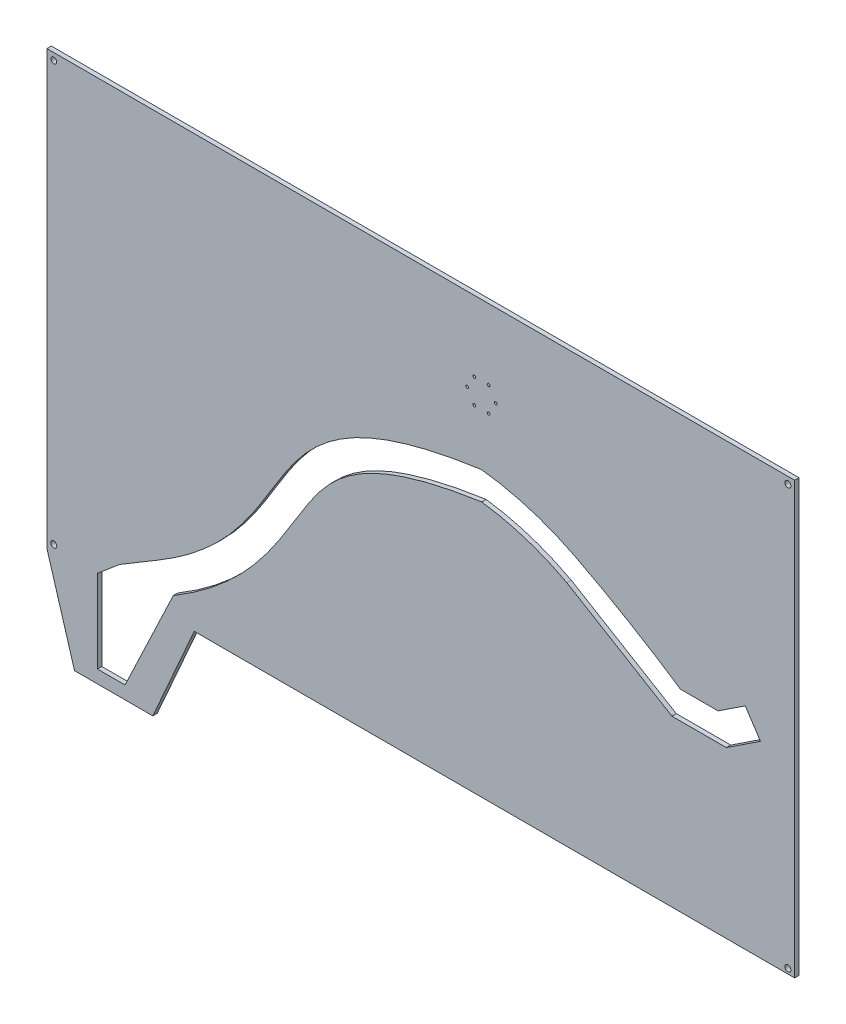
from build123d import *

# Parameters (mm, degrees)
SKETCH1_R           = 3.292374312
SKETCH1_R_2         = 3.294421934
SKETCH1_R_3         = 3.163533699
SKETCH1_R_4         = 1.5
BOSS_EXTRUDE1_DEPTH = 4.7625


with BuildPart() as part:
    # Sketch1 → Boss-Extrude1 (new body)
    with BuildSketch(Plane.XY):
        Polygon((-596.816755826, -150), (-566.816755826, -250), (-481.816755826, -250), (-436.816755826, -147.994392447), (215.080766979, -147.994392447), (215.080766979, 320), (-596.816755826, 320), align=None)
        with Locations((-589.375723826, -142.5578)):
            Circle(SKETCH1_R, mode=Mode.SUBTRACT)
        with Locations((207.642212326, -142.5578)):
            Circle(SKETCH1_R, mode=Mode.SUBTRACT)
        with Locations((207.642212326, 312.5578)):
            Circle(SKETCH1_R_2, mode=Mode.SUBTRACT)
        with Locations((-589.375723826, 312.5578)):
            Circle(SKETCH1_R_3, mode=Mode.SUBTRACT)
        with Locations((-140.5, 230)):
            Circle(SKETCH1_R_4, mode=Mode.SUBTRACT)
        with Locations((-132.75, 243.423393759)):
            Circle(SKETCH1_R_4, mode=Mode.SUBTRACT)
        with Locations((-117.25, 243.423393759)):
            Circle(SKETCH1_R_4, mode=Mode.SUBTRACT)
        with Locations((-109.5, 230)):
            Circle(SKETCH1_R_4, mode=Mode.SUBTRACT)
        with Locations((-117.25, 216.576606241)):
            Circle(SKETCH1_R_4, mode=Mode.SUBTRACT)
        with Locations((-132.75, 216.576606241)):
            Circle(SKETCH1_R_4, mode=Mode.SUBTRACT)
        with BuildLine():
            Line((-475, -100), (-518.031074044, -125.74437106))
            Line((-518.031074044, -125.74437106), (-541.975507322, -146))
            Line((-541.975507322, -146), (-541.975507322, -236))
            Line((-541.975507322, -236), (-511.975507322, -236))
            Line((-511.975507322, -236), (-459.597813184, -125.74437106))
            add(Edge.make_bspline(
                [(-459.597813184, -125.74437106), (-458.129207209, -124.865742348), (-455.185829054, -123.081513508), (-449.471359557, -119.524654219), (-442.555549408, -115.046151368), (-434.636214281, -109.639746192), (-424.556425744, -102.386073958), (-412.829398694, -93.24529863), (-400.055778993, -82.1905419), (-388.486450966, -71.092190732), (-374.537420018, -56.304576734), (-359.620141336, -37.979207276), (-344.890774823, -16.767556206), (-332.340078528, 3.245699555), (-321.055163892, 21.796443272), (-310.225956981, 38.664819129), (-299.079604806, 53.834809894), (-286.812791685, 67.514642691), (-272.431751915, 80.088460877), (-257.652665703, 89.924055398), (-243.498210685, 97.442015492), (-231.565093385, 102.886615769), (-218.172694067, 108.112662921), (-203.190999217, 113.087836875), (-189.281720356, 116.996077726), (-177.243425929, 119.962936855), (-167.745823902, 122.104113686), (-157.766000623, 124.157339904), (-149.036898589, 125.791853127), (-141.799270328, 127.051772068), (-136.243143266, 127.972296195), (-131.502167372, 128.719120718), (-127.648712651, 129.303231945), (-125.690331117, 129.592450023), (-124.714693771, 129.734664734)],
                knots=[0, 0, 0, 0, 0.00777259, 0.01554518, 0.03109036, 0.04663554, 0.062180721, 0.093271081, 0.124361441, 0.155451801, 0.186542162, 0.248722882, 0.310903603, 0.373084323, 0.435265044, 0.497445764, 0.559626485, 0.621807206, 0.683987926, 0.746168647, 0.777259007, 0.808349367, 0.839439728, 0.870530088, 0.901620448, 0.917165628, 0.932710808, 0.948255989, 0.963801169, 0.971573759, 0.979346349, 0.987118939, 0.991005234, 0.994891529, 0.994891529, 0.994891529, 0.994891529], degree=3))
            ThreePointArc((-124.714693771, 129.734664734), (-77.172123272, 119.052933104), (-32.323699215, 100))
            Line((-32.323699215, 100), (81.77450832, 31.56416045))
            Line((81.77450832, 31.56416045), (140.88780849, 31.56416045))
            Line((140.88780849, 31.56416045), (177.923308763, 55.973921994))
            Line((177.923308763, 55.973921994), (161.413907899, 81.022668132))
            Line((161.413907899, 81.022668132), (131.890654865, 61.56416045))
            Line((131.890654865, 61.56416045), (90.97120992, 61.56416045))
            ThreePointArc((90.97120992, 61.56416045), (35.57180112, 96.520479224), (-21.701372103, 128.313911667))
            Line((-21.701372103, 128.313911667), (-25, 130))
            ThreePointArc((-25, 130), (-73.684930832, 149.383563894), (-125, 160))
            add(Edge.make_bspline(
                [(-475, -100), (-419.540575809, -66.820070684), (-329.590802121, 43.11603253), (-307.635554762, 134.287094016), (-125, 160)],
                knots=[0, 0, 0, 0, 0.312223899, 1, 1, 1, 1], degree=3))
        make_face(mode=Mode.SUBTRACT)
    extrude(amount=BOSS_EXTRUDE1_DEPTH)


solid = part.part
